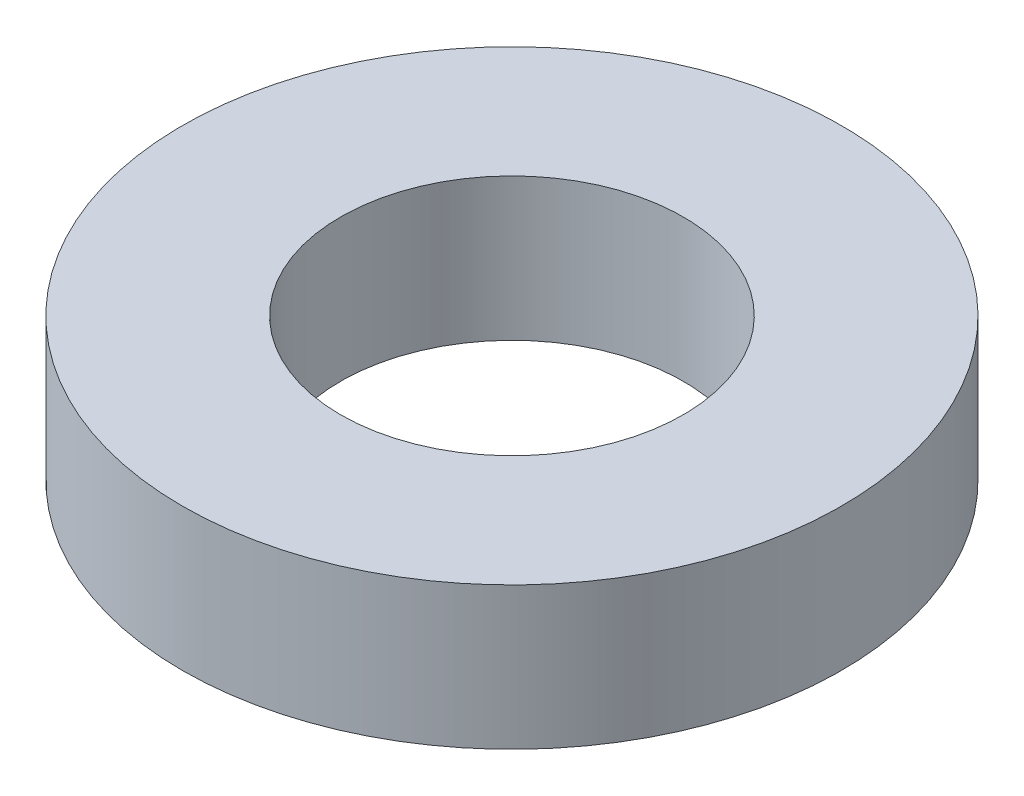
from build123d import *

# Parameters (mm, degrees)
SKETCH1_R           = 62.5
BOSS_EXTRUDE1_DEPTH = 27
SKETCH2_R           = 32.5
CUT_EXTRUDE1_DEPTH  = 93.420235879


with BuildPart() as part:
    # Sketch1 → Boss-Extrude1 (new body)
    with BuildSketch(Plane(origin=(0, 0, 0), x_dir=(1, 0, 0), z_dir=(0, 1, 0))):
        Circle(SKETCH1_R)
    extrude(amount=BOSS_EXTRUDE1_DEPTH)

    # Sketch2 → Cut-Extrude1 (cut, through all)
    with BuildSketch(Plane(origin=(0, 0, 0), x_dir=(1, 0, 0), z_dir=(0, 1, 0))):
        Circle(SKETCH2_R)
    extrude(amount=CUT_EXTRUDE1_DEPTH, mode=Mode.SUBTRACT)


solid = part.part
